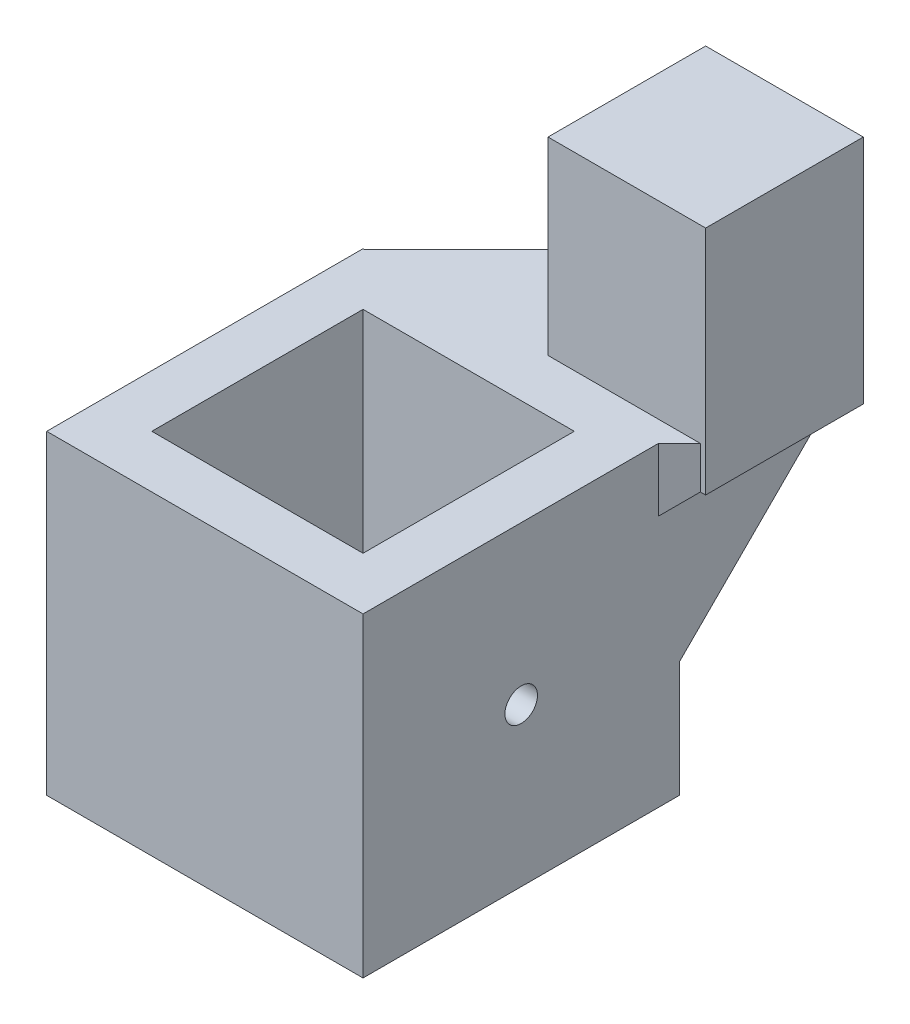
from build123d import *

# Parameters (mm, degrees)
SKETCH4_W                = 20.1
SKETCH4_H                = 20.1
BOSS_EXTRUDE6_DEPTH      = 5
BOSS_EXTRUDE7_DEPTH      = 15
BOSS_EXTRUDE7_DEPTH_BACK = 15
SKETCH4_4_W              = 30.1
SKETCH4_4_H              = 30.1
SKETCH4_4_W_2            = 20.1
SKETCH4_4_H_2            = 20.1
SKETCH5_R                = 1.55
CUT_EXTRUDE1_DEPTH       = 54
BOSS_EXTRUDE8_START      = 15
SKETCH4_5_W              = 15
SKETCH4_5_H              = 15
BOSS_EXTRUDE8_DEPTH      = 18
SKETCH6_W                = 17.5
SKETCH6_H                = 15
BOSS_EXTRUDE9_DEPTH      = 4
CHAMFER1_SIZE            = 15
CHAMFER2_SIZE            = 15
CHAMFER3_SIZE            = 2


with BuildPart() as part:
    # Sketch4 → Boss-Extrude6 (new body)
    with BuildSketch(Plane(origin=(0, 310, 0), x_dir=(1, 0, 0), z_dir=(0, 1, 0))):
        Polygon((5, 25.1), (-7.5, 25.1), (-25.1, 25.1), (-25.1, -5), (5, -5), align=None)
        with Locations((-10.05, 10.05)):
            Rectangle(SKETCH4_W, SKETCH4_H, mode=Mode.SUBTRACT)
    extrude(amount=-BOSS_EXTRUDE6_DEPTH)

    # Sketch4<4> → Boss-Extrude7 (add, two sides: drawn at the far end of the back side and taken through both)
    with BuildSketch(Plane(origin=(0, 310, 0), x_dir=(1, 0, 0), z_dir=(0, 1, 0)).offset(-BOSS_EXTRUDE7_DEPTH_BACK)):
        with Locations((-10.05, 10.05)):
            Rectangle(SKETCH4_4_W, SKETCH4_4_H)
        with Locations((-10.05, 10.05)):
            Rectangle(SKETCH4_4_W_2, SKETCH4_4_H_2, mode=Mode.SUBTRACT)
    extrude(amount=BOSS_EXTRUDE7_DEPTH + BOSS_EXTRUDE7_DEPTH_BACK)

    # Sketch5 → Cut-Extrude1 (cut)
    with BuildSketch(Plane(origin=(5, 0, 0), x_dir=(0, 0, -1), z_dir=(1, 0, 0))):
        with Locations(Location((10.05, 310, 0), (0, 0, 180))):
            Circle(SKETCH5_R)
    extrude(amount=-CUT_EXTRUDE1_DEPTH, mode=Mode.SUBTRACT)



with BuildPart() as body_2:
    # Sketch4<5> → Boss-Extrude8 (new body)
    with BuildSketch(Plane(origin=(0, 310, 0), x_dir=(1, 0, 0), z_dir=(0, 1, 0)).offset(BOSS_EXTRUDE8_START)):
        with Locations((0, 32.6)):
            Rectangle(SKETCH4_5_W, SKETCH4_5_H)
    extrude(amount=BOSS_EXTRUDE8_DEPTH)


with BuildPart() as part_1:
    add(part.part)

    add(body_2.part)  # Boss-Extrude9 merges body 2
    # Sketch6 → Boss-Extrude9 (add)
    with BuildSketch(Plane(origin=(0, 325, 0), x_dir=(1, 0, 0), z_dir=(0, 1, 0))):
        with Locations((-1.25, 32.6)):
            Rectangle(SKETCH6_W, SKETCH6_H)
    extrude(amount=-BOSS_EXTRUDE9_DEPTH)

    # Chamfer1
    chamfer1_edges = [part_1.edges().sort_by_distance(p)[0] for p in [
        (-2.5, 321, -25.1),
    ]]
    chamfer(chamfer1_edges, length=CHAMFER1_SIZE - 0.0001)  # a hair under: the kernel refuses the full size

    # Chamfer2
    chamfer2_edges = [part_1.edges().sort_by_distance(p)[0] for p in [
        (-10, 315.50005, -25.1),
    ]]
    chamfer(chamfer2_edges, length=CHAMFER2_SIZE - 0.0001)  # a hair under: the kernel refuses the full size

    # Chamfer3
    chamfer3_edges = [part_1.edges().sort_by_distance(p)[0] for p in [
        (5, 321, -32.59995),
        (5, 323, -25.1),
    ]]
    chamfer(chamfer3_edges, length=CHAMFER3_SIZE)


solid = part_1.part
